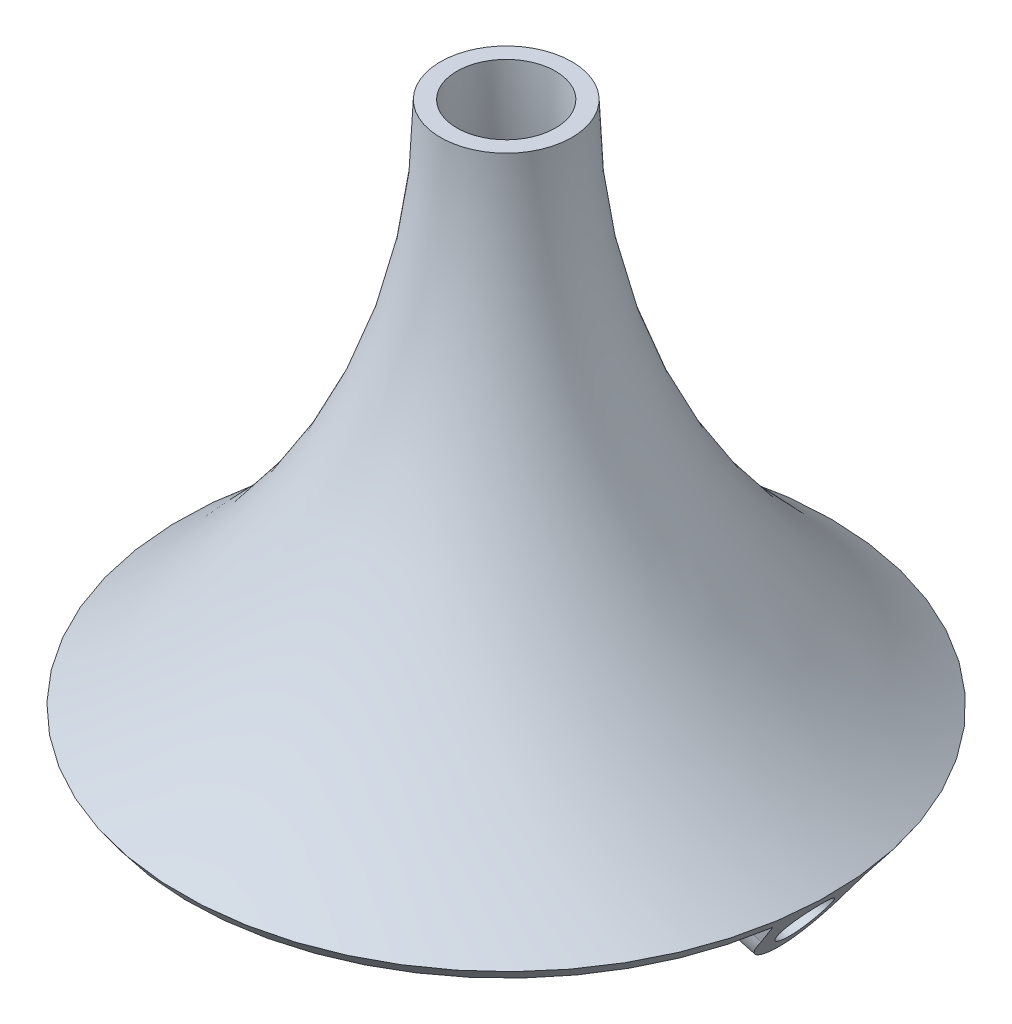
from build123d import *

# Parameters (mm, degrees)
SKETCH3_R           = 4.8895
BOSS_EXTRUDE1_DEPTH = 19.05
CIRPATTERN1_COUNT   = 3


with BuildPart() as part:
    # Sketch1 → Revolve1 (revolve)
    with BuildSketch(Plane.XY):
        with BuildLine():
            Line((63.5, -18.416495048), (61.595, -20.956495048))
            ThreePointArc((61.595, -20.956495048), (23.267940412, 24.967475157), (9.525, 83.183504952))
            Line((9.525, 83.183504952), (12.7, 83.183504952))
            ThreePointArc((12.7, 83.183504952), (26.107746743, 26.387378323), (63.5, -18.416495048))
        make_face()
    revolve(axis=Axis((0, 0, 0), (0, 1, 0)))

    # Sketch2 → Revolve2 (revolve)
    with BuildSketch(Plane.XY):
        Polygon((50.410991538, -18.196307674), (51.232742006, -15.129493176), (63.5, -18.416495048), (62.678249532, -21.483309547), align=None)
    revolve2 = revolve(axis=Axis((49.145495817, -22.919202002, 0), (0.9659258262890681, -0.25881904510252146, 0)))

    # Sketch3 → Boss-Extrude1 (add)
    with BuildSketch(Plane(origin=(63.850430332, -17.108671244, 0), x_dir=(0, 0, -1), z_dir=(0.9659258262890681, -0.2588190451025214, 0))):
        with BuildLine():
            ThreePointArc((-8.0645, -9.418458833), (0, -17.482958833), (8.0645, -9.418458833))
            Line((8.0645, -9.418458833), (13.078126033, 19.01522734))
            Line((13.078126033, 19.01522734), (-13.078126033, 19.01522734))
            Line((-13.078126033, 19.01522734), (-8.0645, -9.418458833))
        make_face()
        with Locations((0, -9.418458833)):
            Circle(SKETCH3_R, mode=Mode.SUBTRACT)
    boss_extrude1 = extrude(amount=-BOSS_EXTRUDE1_DEPTH)

    # Sketch6 → Cut-Revolve1 (revolve, cut)
    with BuildSketch(Plane.XY):
        with BuildLine():
            Line((47.65234783, -8.864093361), (51.960316925, -33.295800168))
            Line((51.960316925, -33.295800168), (62.792262976, -18.416495048))
            ThreePointArc((62.792262976, -18.416495048), (25.9036314, 26.544748764), (12.7, 83.183504952))
            Line((12.7, 83.183504952), (88.192262976, 83.183504952))
            Line((88.192262976, 83.183504952), (88.192262976, -58.695800168))
            Line((88.192262976, -58.695800168), (0, -58.695800168))
            Line((0, -58.695800168), (0, 0))
            Line((0, 0), (39.569908974, 0))
            ThreePointArc((39.569908974, 0), (43.508969842, -4.525196682), (47.65234783, -8.864093361))
        make_face()
    cut_revolve1 = revolve(axis=Axis((0, -58.695800168, 0), (0, 1, 0)), mode=Mode.SUBTRACT)

    # CirPattern1: Revolve2, Boss-Extrude1, Cut-Revolve1 ×3 about axis
    cirpattern1_axis = Axis((0, 0, 0), (0, 1, 0))
    add([revolve2.rotate(cirpattern1_axis, i * 360 / CIRPATTERN1_COUNT) for i in range(1, CIRPATTERN1_COUNT)])
    add([boss_extrude1.rotate(cirpattern1_axis, i * 360 / CIRPATTERN1_COUNT) for i in range(1, CIRPATTERN1_COUNT)])
    add([cut_revolve1.rotate(cirpattern1_axis, i * 360 / CIRPATTERN1_COUNT) for i in range(1, CIRPATTERN1_COUNT)], mode=Mode.SUBTRACT)


solid = part.part
